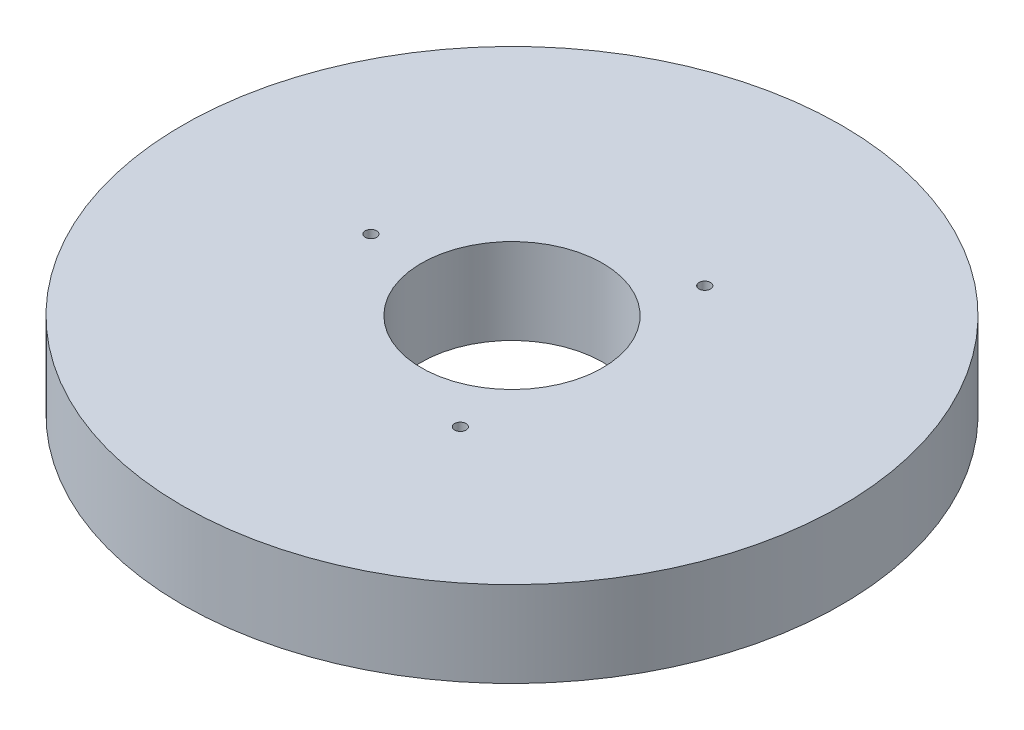
from build123d import *

# Parameters (mm, degrees)
SKETCH1_R           = 100
BOSS_EXTRUDE1_DEPTH = 26
SKETCH2_R           = 27.5
CUT_EXTRUDE1_DEPTH  = 144.791515744
SKETCH3_R           = 1.736360977
CUT_EXTRUDE2_DEPTH  = 22.869163069
CIRPATTERN1_COUNT   = 3


with BuildPart() as part:
    # Sketch1 → Boss-Extrude1 (new body)
    with BuildSketch(Plane(origin=(0, 0, 0), x_dir=(1, 0, 0), z_dir=(0, 1, 0))):
        Circle(SKETCH1_R)
    extrude(amount=BOSS_EXTRUDE1_DEPTH)

    # Sketch2 → Cut-Extrude1 (cut, through all)
    with BuildSketch(Plane(origin=(0, 0, 0), x_dir=(1, 0, 0), z_dir=(0, 1, 0))):
        Circle(SKETCH2_R)
    extrude(amount=CUT_EXTRUDE1_DEPTH, mode=Mode.SUBTRACT)

    # Sketch3 → Cut-Extrude2 (cut)
    with BuildSketch(Plane(origin=(0, 26, 0), x_dir=(1, 0, 0), z_dir=(0, 1, 0))):
        with Locations((-42.812157428, 0)):
            Circle(SKETCH3_R)
    cut_extrude2 = extrude(amount=-CUT_EXTRUDE2_DEPTH, mode=Mode.SUBTRACT)

    # CirPattern1: Cut-Extrude2 ×3 about axis
    cirpattern1_axis = Axis((0, 0, 0), (0, 1, 0))
    for i in range(1, CIRPATTERN1_COUNT):
        add(cut_extrude2.rotate(cirpattern1_axis, i * 360 / CIRPATTERN1_COUNT), mode=Mode.SUBTRACT)


solid = part.part
